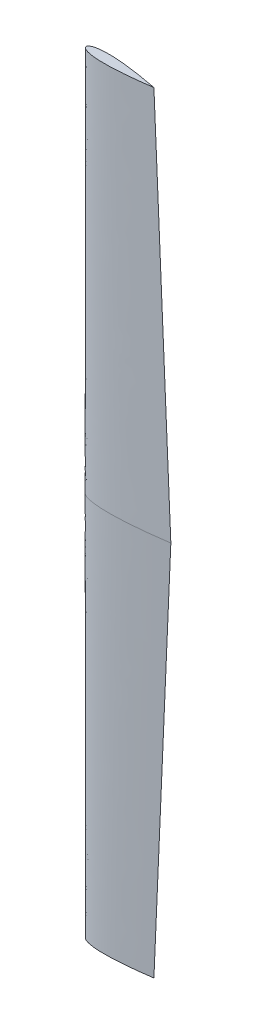
from build123d import *


with BuildPart() as part:
    # rootSketch → Loft1 section 0
    with BuildSketch(Plane(origin=(0, 0, 0), x_dir=(1, 0, 0), z_dir=(0, 1, 0))):
        with BuildLine():
            add(Edge.make_bspline(
                [(0, 0), (-0.00021435, 0.566695332), (0.053916936, 1.483953269), (0.261499161, 2.800586584), (0.777487474, 4.499482309), (1.467220036, 6.07390873), (2.473814648, 7.779894176), (3.898712314, 9.647398572), (5.941668048, 11.755159954), (8.948665654, 14.208325109), (13.529159816, 17.13606324), (20.533584302, 20.565068328), (31.406321847, 24.515253099), (47.729720377, 28.669340355), (72.165628382, 32.634372478), (103.764061404, 35.156937156), (140.72656325, 35.75046068), (175.980891635, 34.591340275), (206.149802497, 32.709253696), (231.254838137, 30.65601145), (251.316132182, 28.760894209), (271.355072076, 26.641948356), (291.37204382, 24.324726086), (311.367144685, 21.828791485), (331.341928453, 19.170269411), (348.800664849, 16.712766681), (363.75446024, 14.517765299), (376.204410913, 12.632257071), (386.164341279, 11.089227243), (398.596778892, 9.121223605), (413.524987959, 6.689639147), (430.891162607, 3.764101492), (450.770566519, 0.275943291), (468.066489394, -2.880614065), (482.992092496, -5.700527903), (495.230488019, -8.074385303), (504.121806203, -9.838547698), (511.081370786, -11.240000371), (516.637636803, -12.378197007), (518.87829502, -12.839780606), (520.000000005, -13.071777839)],
                knots=[0, 0, 0, 0, 0, 0.003845658, 0.006245277, 0.009022611, 0.012044555, 0.015501019, 0.019679599, 0.024953702, 0.03195376, 0.041823539, 0.056555515, 0.077861291, 0.110456483, 0.156156733, 0.224644526, 0.293132328, 0.361620133, 0.395864036, 0.43010794, 0.464351842, 0.498595745, 0.532839648, 0.567083551, 0.601327453, 0.635571356, 0.652693307, 0.669815259, 0.68693721, 0.704059162, 0.738303064, 0.772546967, 0.806790869, 0.841034772, 0.858156724, 0.875278677, 0.892400629, 0.900961606, 0.909522582, 0.909522582, 0.909522582, 0.909522582, 0.909522582], degree=4))
            add(Edge.make_bspline(
                [(0, 0), (-0.028687299, -0.565968801), (-0.020711384, -1.484787991), (0.120455313, -2.810188169), (0.550432053, -4.532863595), (1.160187471, -6.13995659), (2.079794634, -7.894362963), (3.409061107, -9.831101631), (5.343533466, -12.038847737), (8.223475493, -14.639998983), (12.651082086, -17.794183059), (19.474371657, -21.570789698), (30.134902122, -26.062278499), (46.22896421, -31.031276991), (70.434788268, -36.219066644), (101.866566555, -40.326086936), (138.752561973, -42.776016517), (174.020601825, -43.389689824), (204.2459722, -43.025796759), (229.422462848, -42.236533245), (249.553637482, -41.351775661), (269.673732314, -40.242349001), (289.781849008, -38.933792579), (309.877101725, -37.445650663), (329.960232103, -35.794105808), (347.520392906, -34.216909317), (362.565587353, -32.776023572), (375.094549274, -31.518436105), (385.119428297, -30.477785101), (397.635044203, -29.136926488), (412.666571596, -27.458470913), (430.157803657, -25.409179944), (450.18735915, -22.924254533), (467.620035596, -20.640705897), (482.668471662, -18.574280485), (495.010682407, -16.818331208), (503.979409607, -15.503135247), (511.000598992, -14.453131247), (516.607035118, -13.595543), (518.86805524, -13.247122746), (520.000000005, -13.071777839)],
                knots=[0, 0, 0, 0, 0, 0.003845658, 0.006245277, 0.009022611, 0.012044555, 0.015501019, 0.019679599, 0.024953702, 0.03195376, 0.041823539, 0.056555515, 0.077861291, 0.110456483, 0.156156733, 0.224644526, 0.293132328, 0.361620133, 0.395864036, 0.43010794, 0.464351842, 0.498595745, 0.532839648, 0.567083551, 0.601327453, 0.635571356, 0.652693307, 0.669815259, 0.68693721, 0.704059162, 0.738303064, 0.772546967, 0.806790869, 0.841034772, 0.858156724, 0.875278677, 0.892400629, 0.900961606, 0.909522582, 0.909522582, 0.909522582, 0.909522582, 0.909522582], degree=4))
        make_face()
    # tipSketch → Loft1 section 1
    with BuildSketch(Plane(origin=(0, 2311.114, 0), x_dir=(1, 0, 0), z_dir=(0, 1, 0))):
        with BuildLine():
            add(Edge.make_bspline(
                [(0, 0), (-0.000216413, 0.453684696), (0.043156928, 1.187262646), (0.209215861, 2.240269073), (0.621975901, 3.599694811), (1.173783877, 4.859061027), (1.979043236, 6.223952941), (3.118973466, 7.717898374), (4.753331926, 9.40414094), (7.158934411, 11.366652882), (10.823326963, 13.708854951), (16.426868119, 16.452052035), (25.125057043, 19.612204064), (38.183776666, 22.935471273), (57.732502282, 26.107498792), (83.011249679, 28.125549112), (112.5812498, 28.600369059), (140.784714374, 27.673071793), (164.919840476, 26.167403388), (185.003872946, 24.52480859), (201.052900785, 23.008716437), (217.084066466, 21.313556836), (233.097620063, 19.459783986), (249.093741259, 17.463027901), (265.073497601, 15.336224877), (279.040604917, 13.370198234), (291.003455539, 11.614235541), (300.963710933, 10.105767971), (308.931132616, 8.871452199), (318.878055823, 7.296848023), (330.818855378, 5.351946062), (344.714802835, 3.010893861), (360.613589292, 0.221346965), (374.457565919, -2.305395992), (386.386967358, -4.559035218), (396.195850706, -6.461878525), (403.274906903, -7.86617671), (408.898018853, -8.998809456), (413.29259013, -9.898934164), (415.102636014, -10.271824484), (416, -10.45742227)],
                knots=[0, 0, 0, 0, 0, 0.003845658, 0.006245277, 0.009022611, 0.012044555, 0.015501019, 0.019679599, 0.024953702, 0.03195376, 0.041823539, 0.056555515, 0.077861291, 0.110456483, 0.156156733, 0.224644526, 0.293132328, 0.361620133, 0.395864036, 0.43010794, 0.464351842, 0.498595745, 0.532839648, 0.567083551, 0.601327453, 0.635571356, 0.652693307, 0.669815259, 0.68693721, 0.704059162, 0.738303064, 0.772546967, 0.806790869, 0.841034772, 0.858156724, 0.875278677, 0.892400629, 0.900961606, 0.909522582, 0.909522582, 0.909522582, 0.909522582, 0.909522582], degree=4))
            add(Edge.make_bspline(
                [(0, 0), (-0.023011218, -0.453100799), (-0.016550784, -1.187931472), (0.09639082, -2.247951425), (0.440326107, -3.626398995), (0.928161129, -4.911899792), (1.663825347, -6.315527496), (2.727253525, -7.864861028), (4.274823611, -9.631091024), (6.578782642, -11.711992085), (10.120864561, -14.235350756), (15.579498134, -17.256629168), (24.107921185, -20.849824359), (36.983171783, -24.825020601), (56.34783015, -28.975254102), (81.49325383, -32.260868964), (111.002048753, -34.220813688), (139.216482547, -34.711751486), (163.396776219, -34.420637761), (183.53797274, -33.789226149), (199.642904977, -33.081421348), (215.738994739, -32.193877796), (231.825464075, -31.147036424), (247.901707124, -29.956516531), (263.968140108, -28.635291714), (278.01638803, -27.373516032), (290.052356201, -26.220836469), (300.075823284, -25.214720401), (308.095199123, -24.382281293), (318.108673848, -23.309442285), (330.132111928, -21.966954152), (344.128132772, -20.327051206), (360.146997253, -18.339851315), (374.100442814, -16.51188091), (386.128009468, -14.86047277), (396.020110835, -13.452873493), (403.160783881, -12.406031348), (408.833701957, -11.557358593), (413.267948852, -10.87917302), (415.094444189, -10.597698197), (416, -10.45742227)],
                knots=[0, 0, 0, 0, 0, 0.003845658, 0.006245277, 0.009022611, 0.012044555, 0.015501019, 0.019679599, 0.024953702, 0.03195376, 0.041823539, 0.056555515, 0.077861291, 0.110456483, 0.156156733, 0.224644526, 0.293132328, 0.361620133, 0.395864036, 0.43010794, 0.464351842, 0.498595745, 0.532839648, 0.567083551, 0.601327453, 0.635571356, 0.652693307, 0.669815259, 0.68693721, 0.704059162, 0.738303064, 0.772546967, 0.806790869, 0.841034772, 0.858156724, 0.875278677, 0.892400629, 0.900961606, 0.909522582, 0.909522582, 0.909522582, 0.909522582, 0.909522582], degree=4))
        make_face()
    loft1 = loft()

    # Mirror1: Loft1 across plane
    add(loft1.mirror(Plane.ZX))


solid = part.part
